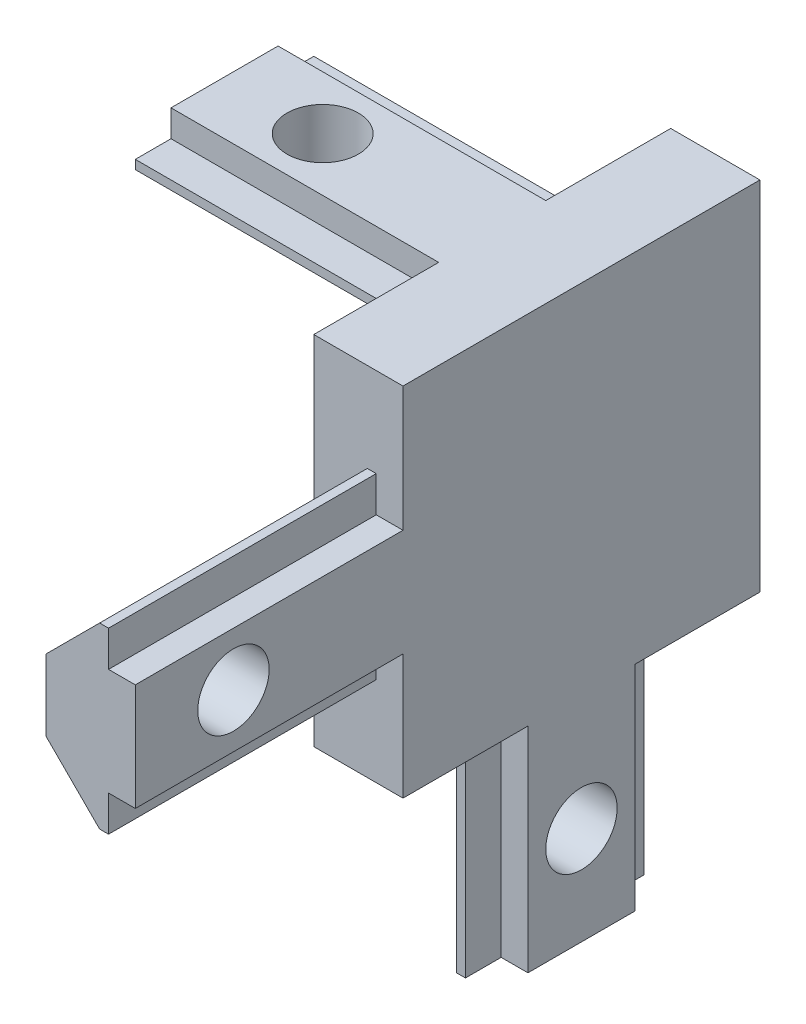
from build123d import *

# Parameters (mm, degrees)
SKETCH1_W               = 20
SKETCH1_H               = 20
SKETCH1_W_2             = 15
SKETCH1_H_2             = 6
SKETCH1_R               = 2
SKETCH1_W_3             = 6
SKETCH1_H_3             = 11.976495928
BOSS_EXTRUDE2_DEPTH     = 1.5
BOSS_EXTRUDE3_DEPTH     = 3.5
SKETCH3_W               = 10
SKETCH3_H               = 11.976495928
SKETCH3_W_2             = 15
SKETCH3_H_2             = 10
BOSS_EXTRUDE4_DEPTH     = 3.5
CUT_EXTRUDE1_DEPTH      = 38.878044984
CUT_EXTRUDE1_DEPTH_BACK = 38.878044984
SKETCH5_R               = 2
SKETCH6_W               = 1.5
SKETCH6_H               = 6
SKETCH6_W_2             = 6
SKETCH6_H_2             = 1.5
BOSS_EXTRUDE6_DEPTH     = 15
CHAMFER1_SIZE           = 3
CUT_EXTRUDE4_DEPTH      = 43.008883487
CUT_EXTRUDE4_DEPTH_BACK = 43.008883487
SKETCH7_R               = 2
CUT_EXTRUDE5_DEPTH      = 51.889549928
CUT_EXTRUDE5_DEPTH_BACK = 51.889549928
SKETCH8_R               = 2


with BuildPart() as part:
    # Sketch1 → Boss-Extrude2 (new body)
    # profile 1 of 3: a face of its own
    with BuildSketch(Plane(origin=(0, 0, 0), x_dir=(0, 0, -1), z_dir=(1, 0, 0))):
        with Locations((10, 21.976495928)):
            Rectangle(SKETCH1_W, SKETCH1_H)
    # profile 2 of 3: a face of its own
    with BuildSketch(Plane(origin=(0, 0, 0), x_dir=(0, 0, -1), z_dir=(1, 0, 0))):
        with Locations((-7.5, 21.976495928)):
            Rectangle(SKETCH1_W_2, SKETCH1_H_2)
        with Locations((-9.5, 21.976495928)):
            Circle(SKETCH1_R, mode=Mode.SUBTRACT)
    # profile 3 of 3: a face of its own
    with BuildSketch(Plane(origin=(0, 0, 0), x_dir=(0, 0, -1), z_dir=(1, 0, 0))):
        with Locations((10, 5.988247964)):
            Rectangle(SKETCH1_W_3, SKETCH1_H_3)
        with Locations((10, 5.5)):
            Circle(SKETCH1_R, mode=Mode.SUBTRACT)
    extrude(amount=BOSS_EXTRUDE2_DEPTH)

    # Sketch2 → Boss-Extrude3 (add)
    with BuildSketch(Plane.ZY):
        Polygon((-20, 31.976495928), (0, 31.976495928), (0, 24.976495928), (0, 11.976495928), (-20, 11.976495928), align=None)
    extrude(amount=BOSS_EXTRUDE3_DEPTH)

    # Sketch3 → Boss-Extrude4 (add)
    with BuildSketch(Plane.ZY):
        with Locations((-10, 5.988247964)):
            Rectangle(SKETCH3_W, SKETCH3_H)
        with Locations((7.5, 21.976495928)):
            Rectangle(SKETCH3_W_2, SKETCH3_H_2)
    extrude(amount=BOSS_EXTRUDE4_DEPTH)

    # Sketch5 → Cut-Extrude1 (cut, two sides: drawn at the far end of the back side and taken through both)
    with BuildSketch(Plane(origin=(0, 0, 0), x_dir=(0, 0, -1), z_dir=(1, 0, 0)).offset(-CUT_EXTRUDE1_DEPTH_BACK)):
        with Locations((-9.5, 21.976495928)):
            Circle(SKETCH5_R)
        with Locations((10, 5.5)):
            Circle(SKETCH5_R)
    extrude(amount=CUT_EXTRUDE1_DEPTH + CUT_EXTRUDE1_DEPTH_BACK, mode=Mode.SUBTRACT)

    # Sketch6 → Boss-Extrude6 (add)
    with BuildSketch(Plane.ZY.offset(3.5)):
        Polygon((-18.5, 26.976495928), (-18.5, 24.976495928), (-18.5, 18.976495928), (-18.5, 16.976495928), (-18, 16.976495928), (-15, 19.976495928), (-15, 23.976495928), (-18, 26.976495928), align=None)
        with Locations((-19.25, 21.976495928)):
            Rectangle(SKETCH6_W, SKETCH6_H)
        Polygon((-5, 29.976495928), (-5, 30.476495928), (-7, 30.476495928), (-13, 30.476495928), (-15, 30.476495928), (-15, 29.976495928), (-12, 26.976495928), (-8, 26.976495928), align=None)
        with Locations((-10, 31.226495928)):
            Rectangle(SKETCH6_W_2, SKETCH6_H_2)
    extrude(amount=BOSS_EXTRUDE6_DEPTH)

    # Chamfer1
    chamfer1_edges = [part.edges().sort_by_distance(p)[0] for p in [
        (-3.5, 5.988247964, -15),
        (-3.5, 5.988247964, -5),
        (-3.5, 16.976495928, 7.5),
        (-3.5, 26.976495928, 7.5),
    ]]
    chamfer(chamfer1_edges, length=CHAMFER1_SIZE - 0.0001)  # a hair under: the kernel refuses the full size

    # Sketch7 → Cut-Extrude4 (cut, two sides: drawn at the far end of the back side and taken through both)
    with BuildSketch(Plane(origin=(0, 31.976495928, 0), x_dir=(1, 0, 0), z_dir=(0, 1, 0)).offset(-CUT_EXTRUDE4_DEPTH_BACK)):
        with Locations(Location((-13, 10, 0), (0, 0, 270))):
            Circle(SKETCH7_R)
    extrude(amount=CUT_EXTRUDE4_DEPTH + CUT_EXTRUDE4_DEPTH_BACK, mode=Mode.SUBTRACT)

    # Sketch8 → Cut-Extrude5 (cut, two sides: drawn at the far end of the back side and taken through both)
    with BuildSketch(Plane(origin=(0, 0, -20), x_dir=(-1, 0, 0), z_dir=(0, 0, -1)).offset(-CUT_EXTRUDE5_DEPTH_BACK)):
        with Locations((13, 21.976495928)):
            Circle(SKETCH8_R)
    extrude(amount=CUT_EXTRUDE5_DEPTH + CUT_EXTRUDE5_DEPTH_BACK, mode=Mode.SUBTRACT)


solid = part.part
